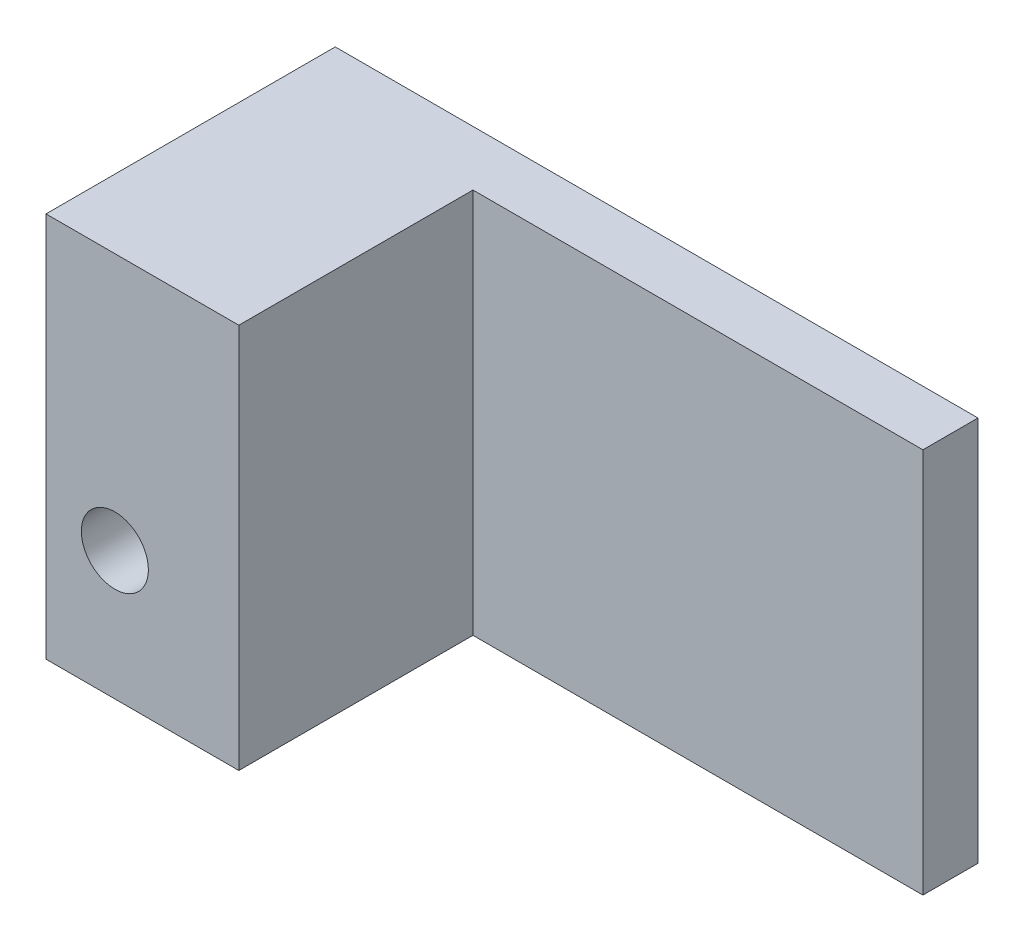
from build123d import *

# Parameters (mm, degrees)
BOSS_EXTRUDE1_DEPTH = 21
SKETCH2_R           = 1.825
CUT_EXTRUDE1_DEPTH  = 3


with BuildPart() as part:
    # Sketch1 → Boss-Extrude1 (new body)
    with BuildSketch(Plane(origin=(0, 0, 0), x_dir=(1, 0, 0), z_dir=(0, 1, 0))):
        Polygon((-24.5, 0), (-24.5, 12.75), (0, 12.75), (0, 15.75), (-35, 15.75), (-35, 0), align=None)
    extrude(amount=BOSS_EXTRUDE1_DEPTH)

    # Sketch2 → Cut-Extrude1 (cut)
    with BuildSketch(Plane.XY):
        with Locations((-31.25, 7)):
            Circle(SKETCH2_R)
    extrude(amount=-CUT_EXTRUDE1_DEPTH, mode=Mode.SUBTRACT)


solid = part.part
